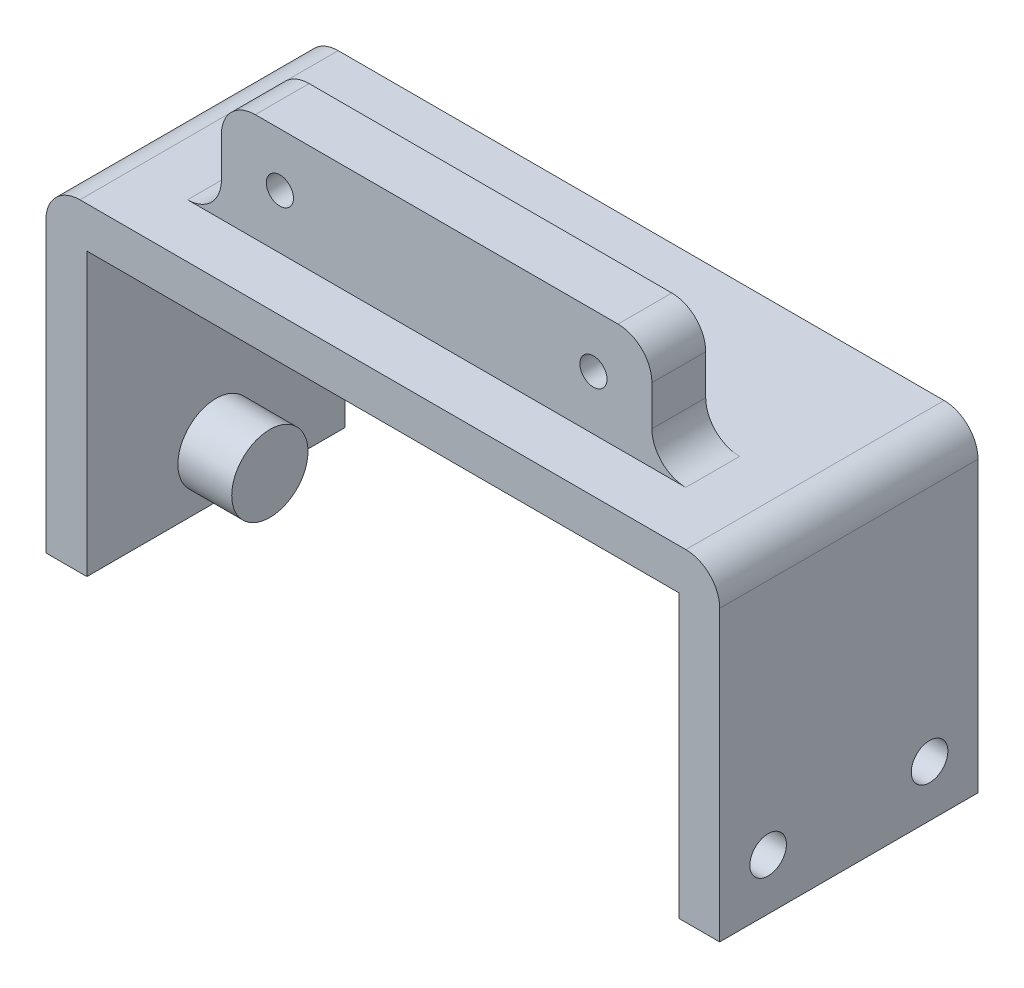
from build123d import *

# Parameters (mm, degrees)
SKETCH2_W           = 30.48
SKETCH2_H           = 38.1
SKETCH2_R           = 2.159
BOSS_EXTRUDE1_DEPTH = 4.826
SKETCH3_W           = 30.48
SKETCH3_H           = 4.826
BOSS_EXTRUDE2_DEPTH = 74.676
SKETCH4_W           = 4.826
SKETCH4_H           = 30.48
BOSS_EXTRUDE4_DEPTH = 33.274
SKETCH5_W           = 50.8
SKETCH5_H           = 6.35
BOSS_EXTRUDE5_DEPTH = 12.7
CUT_EXTRUDE1_REACH  = 94.05
SKETCH6_R           = 1.6
FILLET2_R           = 4
SKETCH7_R           = 4.5
BOSS_EXTRUDE6_DEPTH = 6.35


with BuildPart() as part:
    # Sketch2 → Boss-Extrude1 (new body)
    with BuildSketch(Plane(origin=(0, 0, 0), x_dir=(0, 0, -1), z_dir=(1, 0, 0))):
        with Locations((15.24, 19.05)):
            Rectangle(SKETCH2_W, SKETCH2_H)
        with Locations((5.715, 6.05)):
            Circle(SKETCH2_R, mode=Mode.SUBTRACT)
        with Locations((24.765, 6.05)):
            Circle(SKETCH2_R, mode=Mode.SUBTRACT)
    extrude(amount=BOSS_EXTRUDE1_DEPTH)

    # Sketch3 → Boss-Extrude2 (add)
    with BuildSketch(Plane.ZY):
        with Locations((-15.24, 35.687)):
            Rectangle(SKETCH3_W, SKETCH3_H)
    extrude(amount=BOSS_EXTRUDE2_DEPTH)

    # Sketch4 → Boss-Extrude4 (add)
    with BuildSketch(Plane.XZ.offset(-33.274)):
        with Locations((-72.263, -15.24)):
            Rectangle(SKETCH4_W, SKETCH4_H)
    extrude(amount=BOSS_EXTRUDE4_DEPTH)

    # Sketch5 → Boss-Extrude5 (add)
    with BuildSketch(Plane(origin=(0, 38.1, 0), x_dir=(1, 0, 0), z_dir=(0, 1, 0))):
        with Locations((-34.925, 9.525)):
            Rectangle(SKETCH5_W, SKETCH5_H)
    extrude(amount=BOSS_EXTRUDE5_DEPTH)

    # Sketch6 → Cut-Extrude1 (cut, up to next)
    with BuildSketch(Plane(origin=(0, 0, -12.7), x_dir=(-1, 0, 0), z_dir=(0, 0, -1)), mode=Mode.PRIVATE) as cut_extrude1_sk1:
        with Locations((16.425, 44.5)):
            Circle(SKETCH6_R)
    cut_extrude1_tool1 = extrude(cut_extrude1_sk1.sketch, amount=-CUT_EXTRUDE1_REACH, mode=Mode.PRIVATE) & part.part
    # Sketch6 → Cut-Extrude1 (cut, up to next)
    with BuildSketch(Plane(origin=(0, 0, -12.7), x_dir=(-1, 0, 0), z_dir=(0, 0, -1)), mode=Mode.PRIVATE) as cut_extrude1_sk2:
        with Locations((53.425, 44.5)):
            Circle(SKETCH6_R)
    cut_extrude1_tool2 = extrude(cut_extrude1_sk2.sketch, amount=-CUT_EXTRUDE1_REACH, mode=Mode.PRIVATE) & part.part
    add(cut_extrude1_tool1.solids().sort_by_distance((-16.425, 44.5, -12.7))[0], mode=Mode.SUBTRACT)
    add(cut_extrude1_tool2.solids().sort_by_distance((-53.425, 44.5, -12.7))[0], mode=Mode.SUBTRACT)

    # Fillet2
    fillet2_edges = [part.edges().sort_by_distance(p)[0] for p in [
        (-74.676, 38.1, -15.24),
        (4.826, 38.1, -15.24),
        (-60.325, 50.8, -9.525),
        (-60.325, 38.1, -9.525),
        (-9.525, 38.1, -9.525),
        (-9.525, 50.8, -9.525),
    ]]
    fillet(fillet2_edges, radius=FILLET2_R)

    # Sketch7 → Boss-Extrude6 (add)
    with BuildSketch(Plane(origin=(-69.85, 0, 0), x_dir=(0, 0, -1), z_dir=(1, 0, 0))):
        with Locations((15.24, 6.096)):
            Circle(SKETCH7_R)
    extrude(amount=BOSS_EXTRUDE6_DEPTH)


solid = part.part
